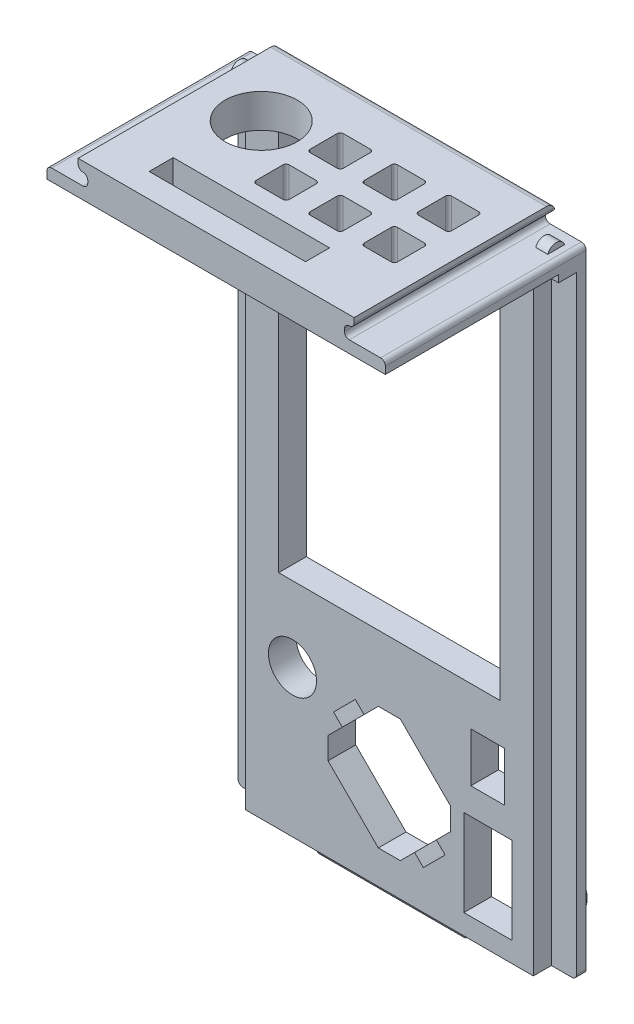
from build123d import *

# Parameters (mm, degrees)
SKETCH_2_W                     = 2.80320188
SKETCH_2_H                     = 4.10319928
SKETCH_2_R                     = 2
SKETCH_2_W_2                   = 3.99999908
SKETCH_2_H_2                   = 7.20319816
EXTRUDE_1_DEPTH                = 2.3
EXTRUDE_2_DEPTH                = 14.4
EXTRUDE_2_DEPTH_BACK           = 2.3
SKETCH_3_W                     = 28.14
SKETCH_3_H                     = 3.4
SKETCH_4_R                     = 3
CUT_EXTRUDE_1_DEPTH            = 3.4
SKETCH_2_3_W                   = 2.1
SKETCH_2_3_H                   = 50.95
CUT_EXTRUDE_2_DEPTH            = 1.5
CUT_EXTRUDE_3_REACH            = 62.506
SKETCH_7_W                     = 28.14
SKETCH_7_H                     = 0.6
SKETCH_8_W                     = 13
SKETCH_8_H                     = 2
CUT_EXTRUDE_4_DEPTH            = 2.8
CUT_EXTRUDE_5_DEPTH            = 16.7
EXTRUDE_3_DEPTH                = 1
EXTRUDE_4_DEPTH                = 6
EXTRUDE_4_DEPTH_BACK           = 6
FILLET_1_R                     = 0.4
FILLET_2_R                     = 0.7
FILLET_3_R                     = 0.4
SKETCH_12_W                    = 2.753
SKETCH_12_H                    = 2.75
CUT_EXTRUDE_6_DEPTH            = 2.8
FILLET_4_R                     = 0.25
PATTERN_LINEAR_1_COUNT         = 3
PATTERN_LINEAR_1_PITCH         = 4.5
PATTERN_LINEAR_1_COUNT_DIR2    = 2
PATTERN_LINEAR_1_PITCH_DIR2    = 4.5
FILLET_4_OF_PATTERN_LINEAR_1_R = 0.25
EXTRUDE_5_DEPTH                = 0.3
FILLET_6_R                     = 0.3
FILLET_5_R                     = 0.15


with BuildPart() as part:
    # 草图2 → 凸台-拉伸1 (new body)
    with BuildSketch(Plane.XY):
        Polygon((-0.1, 0), (-0.1, -50.95), (28.04, -50.95), (28.04, 0), (23.17, 0), (23.17, -32.5), (4.77, -32.5), (4.77, 0), align=None)
        with Locations((22.14500143, -37.80800287)):
            Rectangle(SKETCH_2_W, SKETCH_2_H, mode=Mode.SUBTRACT)
        with Locations((5.9182, -38.735)):
            Circle(SKETCH_2_R, mode=Mode.SUBTRACT)
        Polygon((19.066193866, -43.992617401), (17.88030086, -45.178511502), (18.608616214, -45.906826856), (16.798423264, -47.717019806), (16.070108746, -46.988705288), (14.884217409, -48.174597721), (13.055787589, -48.174595399), (8.873804338, -43.992612148), (8.873804338, -42.164191444), (10.05969962, -40.978296162), (9.331380194, -40.249976736), (11.141573144, -38.439783786), (11.86989257, -39.168103212), (13.055787589, -37.982208193), (14.884217273, -37.982205871), (19.066193866, -42.164182464), align=None, mode=Mode.SUBTRACT)
        with Locations((22.16999884, -45.67000137)):
            Rectangle(SKETCH_2_W_2, SKETCH_2_H_2, mode=Mode.SUBTRACT)
    extrude(amount=-EXTRUDE_1_DEPTH)

    # 草图3 → 凸台-拉伸2 (add, two sides: drawn at the far end of the back side and taken through both)
    with BuildSketch(Plane.XY.offset(-EXTRUDE_2_DEPTH_BACK)):
        with Locations((13.97, 1.7)):
            Rectangle(SKETCH_3_W, SKETCH_3_H)
    extrude(amount=EXTRUDE_2_DEPTH + EXTRUDE_2_DEPTH_BACK)

    # 草图4 → 切除-拉伸1 (cut)
    with BuildSketch(Plane(origin=(0, 3.4, 0), x_dir=(1, 0, 0), z_dir=(0, 1, 0))):
        with Locations(Location((7.41680127, -4.1, 0), (0, 0, 270))):
            Circle(SKETCH_4_R)
    extrude(amount=-CUT_EXTRUDE_1_DEPTH, mode=Mode.SUBTRACT)

    # 草图2<3> → 切除-拉伸2 (cut)
    with BuildSketch(Plane.XY):
        with Locations((0.95, -25.475)):
            Rectangle(SKETCH_2_3_W, SKETCH_2_3_H)
        with Locations((26.99, -25.475)):
            Rectangle(SKETCH_2_3_W, SKETCH_2_3_H)
    extrude(amount=-CUT_EXTRUDE_2_DEPTH, mode=Mode.SUBTRACT)

    # 切除-拉伸3: up to this face of the body (flat: up to its plane)
    cut_extrude_3_end = Plane(part.part.faces().sort_by_distance((13.97, -33.062941036, 0))[0])
    # 草图7 → 切除-拉伸3 (cut, up to the picked face)
    with BuildSketch(Plane.XY.offset(14.4), mode=Mode.PRIVATE) as cut_extrude_3_sk1:
        with Locations((13.97, 0.3)):
            Rectangle(SKETCH_7_W, SKETCH_7_H)
    cut_extrude_3_tool1 = split(extrude(cut_extrude_3_sk1.sketch, amount=-CUT_EXTRUDE_3_REACH, mode=Mode.PRIVATE), bisect_by=cut_extrude_3_end, keep=Keep.BOTH, mode=Mode.PRIVATE)
    add(cut_extrude_3_tool1.solids().sort_by(Axis((13.97, 0.3, 14.4), (0, 0, -1)))[0], mode=Mode.SUBTRACT)

    # 草图8 → 切除-拉伸4 (cut)
    with BuildSketch(Plane.XZ.offset(-0.6)):
        with Locations((12.9, 11.4)):
            Rectangle(SKETCH_8_W, SKETCH_8_H)
    extrude(amount=-CUT_EXTRUDE_4_DEPTH, mode=Mode.SUBTRACT)

    # 草图9 → 切除-拉伸5 (cut)
    with BuildSketch(Plane.XY.offset(14.4)):
        Polygon((2.5, 2.6), (3.3, 2.6), (3.3, 1.6), (-0.1, 1.6), (-0.1, 3.4), (2.5, 3.4), align=None)
        Polygon((28.04, 3.4), (25.44, 3.4), (25.44, 2.6), (24.64, 2.6), (24.64, 1.6), (28.04, 1.6), align=None)
    extrude(amount=-CUT_EXTRUDE_5_DEPTH, mode=Mode.SUBTRACT)

    # 草图10 → 凸台-拉伸3 (add)
    with BuildSketch(Plane.ZY.offset(-0.8)):
        with BuildLine():
            Line((-1.4, 1.6), (0, 1.6))
            ThreePointArc((0, 1.6), (-0.7, 2.1), (-1.4, 1.6))
        make_face()
    extrude_3 = extrude(amount=-EXTRUDE_3_DEPTH)

    # 镜向1: 凸台-拉伸3 across plane
    add(extrude_3.mirror(Plane.ZY.offset(-13.97)))

    # 草图11 → 凸台-拉伸4 (add, two sides: drawn at the far end of the back side and taken through both)
    with BuildSketch(Plane.ZY.offset(-13.97).offset(-EXTRUDE_4_DEPTH_BACK)):
        with BuildLine():
            Line((-1.4, -50.95), (0, -50.95))
            ThreePointArc((0, -50.95), (-0.7, -51.45), (-1.4, -50.95))
        make_face()
    extrude(amount=EXTRUDE_4_DEPTH + EXTRUDE_4_DEPTH_BACK)

    # 圆角1
    fillet_1_edges = [part.edges().sort_by_distance(p)[0] for p in [
        (3.3, 1.6, 6.05),
        (3.3, 2.6, 6.05),
        (2.5, 2.6, 6.05),
        (24.64, 1.6, 6.05),
        (24.64, 2.6, 6.05),
        (25.44, 2.6, 6.05),
    ]]
    fillet(fillet_1_edges, radius=FILLET_1_R - 0.0001)  # a hair under: the kernel refuses the full size

    # 圆角2
    fillet_2_edges = [part.edges().sort_by_distance(p)[0] for p in [
        (13.97, 3.4, -2.3),
    ]]
    fillet(fillet_2_edges, radius=FILLET_2_R)

    # 圆角3
    fillet_3_edges = [part.edges().sort_by_distance(p)[0] for p in [
        (28.04, 1.6, 6.05),
        (-0.1, 1.6, 6.05),
        (-0.1, -50.95, -1.9),
        (28.04, -50.95, -1.9),
    ]]
    fillet(fillet_3_edges, radius=FILLET_3_R)

    # 草图12 → 切除-拉伸6 (cut)
    with BuildSketch(Plane(origin=(0, 3.4, 0), x_dir=(1, 0, 0), z_dir=(0, 1, 0))):
        with Locations((21.8635, -2.975)):
            Rectangle(SKETCH_12_W, SKETCH_12_H)
    cut_extrude_6 = extrude(amount=-CUT_EXTRUDE_6_DEPTH, mode=Mode.SUBTRACT)

    # 圆角4
    fillet_4_edges = [part.edges().sort_by_distance(p)[0] for p in [
        (23.24, 2, 1.6),
        (23.24, 2, 4.35),
        (20.487, 2, 4.35),
        (20.487, 2, 1.6),
    ]]
    fillet(fillet_4_edges, radius=FILLET_4_R)

    # 阵列(线性)1: Cut-Extrude 6 3 × 2
    with Locations(*[(-i * PATTERN_LINEAR_1_PITCH, 0, j * PATTERN_LINEAR_1_PITCH_DIR2) for i in range(PATTERN_LINEAR_1_COUNT) for j in range(PATTERN_LINEAR_1_COUNT_DIR2) if (i, j) != (0, 0)]):
        add(cut_extrude_6, mode=Mode.SUBTRACT)

    # 圆角4 of 阵列(线性)1
    fillet_4_of_pattern_linear_1_edges = [part.edges().sort_by_distance(p)[0] for p in [
        (23.24, 2, 6.1),
        (23.24, 2, 8.85),
        (20.487, 2, 8.85),
        (20.487, 2, 6.1),
        (18.74, 2, 1.6),
        (18.74, 2, 4.35),
        (15.987, 2, 4.35),
        (15.987, 2, 1.6),
        (18.74, 2, 6.1),
        (18.74, 2, 8.85),
        (15.987, 2, 8.85),
        (15.987, 2, 6.1),
        (14.24, 2, 1.6),
        (14.24, 2, 4.35),
        (11.487, 2, 4.35),
        (11.487, 2, 1.6),
        (14.24, 2, 6.1),
        (14.24, 2, 8.85),
        (11.487, 2, 8.85),
        (11.487, 2, 6.1),
    ]]
    fillet(fillet_4_of_pattern_linear_1_edges, radius=FILLET_4_OF_PATTERN_LINEAR_1_R)

    # 草图13 → 凸台-拉伸5 (add)
    with BuildSketch(Plane(origin=(0, 0, -2.3), x_dir=(-1, 0, 0), z_dir=(0, 0, -1))):
        with BuildLine():
            Line((-25.256471053, -44.821473233), (-24.832206984, -44.397209164))
            ThreePointArc((-24.832206984, -44.397209164), (-27.90499919, -45.67000137), (-24.832206984, -46.942793576))
            Line((-24.832206984, -46.942793576), (-25.256471053, -46.518529507))
            ThreePointArc((-25.256471053, -46.518529507), (-27.30499919, -45.67000137), (-25.256471053, -44.821473233))
        make_face()
        with BuildLine():
            Line((-26.10499919, -45.37000137), (-24.60499919, -45.37000137))
            ThreePointArc((-24.60499919, -45.37000137), (-24.30499919, -45.67000137), (-24.60499919, -45.97000137))
            Line((-24.60499919, -45.97000137), (-26.10499919, -45.97000137))
            ThreePointArc((-26.10499919, -45.97000137), (-26.40499919, -45.67000137), (-26.10499919, -45.37000137))
        make_face()
    extrude(amount=EXTRUDE_5_DEPTH)

    # 圆角6
    fillet_6_edges = [part.edges().sort_by_distance(p)[0] for p in [
        (24.832206984, -46.942793576, -2.45),
        (25.256471053, -46.518529507, -2.45),
        (25.256471053, -44.821473233, -2.45),
        (24.832206984, -44.397209164, -2.45),
    ]]
    fillet(fillet_6_edges, radius=FILLET_6_R - 0.0001)  # a hair under: the kernel refuses the full size

    # 圆角5
    fillet_5_edges = [part.edges().sort_by_distance(p)[0] for p in [
        (26.40499919, -45.67000137, -2.6),
        (25.35499919, -45.97000137, -2.6),
        (24.30499919, -45.67000137, -2.6),
        (25.35499919, -45.37000137, -2.6),
        (27.90499919, -45.67000137, -2.6),
        (27.30499919, -45.67000137, -2.6),
        (24.979360848, -44.388492506, -2.6),
        (25.247753249, -44.717149471, -2.6),
        (25.247753249, -46.622853269, -2.6),
        (24.979360848, -46.951510234, -2.6),
    ]]
    fillet(fillet_5_edges, radius=FILLET_5_R)


solid = part.part
